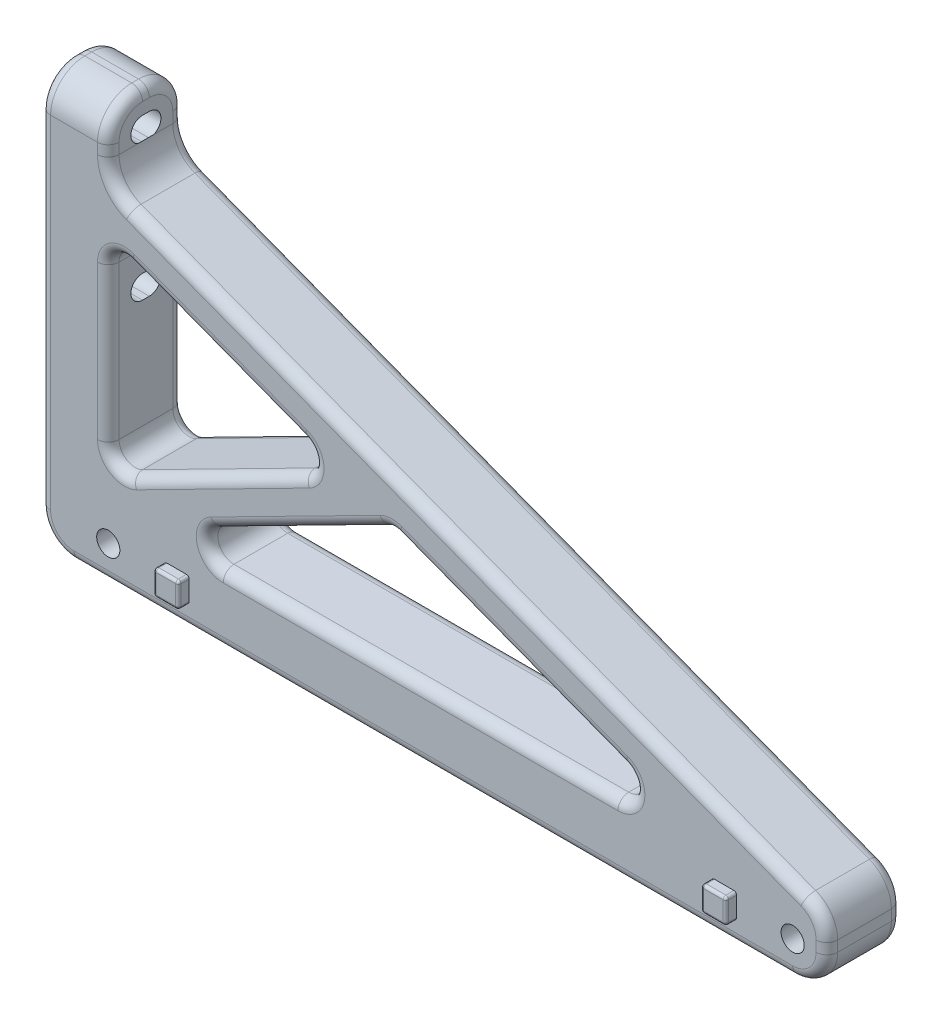
from build123d import *

# Parameters (mm, degrees)
SKETCH1_R           = 2.15
BOSS_EXTRUDE1_DEPTH = 13.97
FILLET1_R           = 3
FILLET2_R           = 6.35
CUT_EXTRUDE1_DEPTH  = 152.183351927
FILLET3_R           = 2
SKETCH3_W           = 4.6228
SKETCH3_H           = 4.6228
BOSS_EXTRUDE2_DEPTH = 2
FILLET4_R           = 0.508


with BuildPart() as part:
    # Sketch1 → Boss-Extrude1 (new body)
    with BuildSketch(Plane.XY):
        Polygon((133.35, 6.35), (0, 57.15), (0, 69.85), (-12.7, 69.85), (-12.7, -6.35), (133.35, -6.35), align=None)
        Circle(SKETCH1_R, mode=Mode.SUBTRACT)
        Polygon((0, 10.838020995), (0, 48.589159979), (42.42795548, 32.42612932), align=None, mode=Mode.SUBTRACT)
        Polygon((110.877794946, 6.35), (8.820483578, 6.35), (52.515998389, 28.583065355), align=None, mode=Mode.SUBTRACT)
        with Locations((127, 0)):
            Circle(SKETCH1_R, mode=Mode.SUBTRACT)
    extrude(amount=BOSS_EXTRUDE1_DEPTH)

    # Fillet1
    fillet1_edges = [part.edges().sort_by_distance(p)[0] for p in [
        (110.877794946, 6.35, 6.985),
        (52.515998389, 28.583065355, 6.985),
        (8.820483578, 6.35, 6.985),
        (0, 10.838020995, 6.985),
        (42.42795548, 32.42612932, 6.985),
        (0, 48.589159979, 6.985),
    ]]
    fillet(fillet1_edges, radius=FILLET1_R)

    # Fillet2
    fillet2_edges = [part.edges().sort_by_distance(p)[0] for p in [
        (133.35, 6.35, 6.985),
        (133.35, -6.35, 6.985),
        (-12.7, -6.35, 6.985),
        (0, 57.15, 6.985),
        (-6.35, 69.85, 0),
        (-6.35, 69.85, 13.97),
    ]]
    fillet(fillet2_edges, radius=FILLET2_R)

    # Sketch2 → Cut-Extrude1 (cut, through all)
    with BuildSketch(Plane(origin=(0, 0, 0), x_dir=(0, 0, -1), z_dir=(1, 0, 0))):
        with BuildLine():
            Line((-7.62, 65.65), (-6.35, 65.65))
            ThreePointArc((-6.35, 65.65), (-4.2, 63.5), (-6.35, 61.35))
            Line((-6.35, 61.35), (-7.62, 61.35))
            ThreePointArc((-7.62, 61.35), (-9.77, 63.5), (-7.62, 65.65))
        make_face()
        with BuildLine():
            Line((-7.62, 35.95), (-6.35, 35.95))
            ThreePointArc((-6.35, 35.95), (-4.2, 38.1), (-6.35, 40.25))
            Line((-6.35, 40.25), (-7.62, 40.25))
            ThreePointArc((-7.62, 40.25), (-9.77, 38.1), (-7.62, 35.95))
        make_face()
    extrude(amount=-CUT_EXTRUDE1_DEPTH, mode=Mode.SUBTRACT)

    # Fillet3
    fillet3_edges = [part.edges().sort_by_distance(p)[0] for p in [
        (1.431785869, 13.173010707, 0),
        (0, 29.983239316, 0),
        (1.297642509, 46.706206235, 0),
        (20.086442529, 40.937181873, 0),
        (38.032644918, 32.191420837, 0),
        (97.526174762, 8.80704034, 0),
        (57.953790951, 6.35, 0),
        (18.414557487, 8.650483328, 0),
        (35.65095639, 20.001828068, 0),
        (52.531016852, 28.301819395, 0),
        (18.414557487, 8.650483328, 13.97),
        (57.953790951, 6.35, 13.97),
        (97.526174762, 8.80704034, 13.97),
        (74.701339099, 20.131506989, 13.97),
        (52.531016852, 28.301819395, 13.97),
        (38.032644918, 32.191420837, 13.97),
        (20.378926173, 21.207185872, 13.97),
        (1.431785869, 13.173010707, 13.97),
        (0, 29.983239316, 13.97),
        (1.297642509, 46.706206235, 13.97),
        (132.22862896, 5.577204208, 13.97),
        (133.35, 0.986940426, 13.97),
        (131.490128061, -4.490128061, 13.97),
        (60.325, -6.35, 13.97),
        (-10.840128061, -4.490128061, 13.97),
        (-12.7, 31.75, 13.97),
        (-12.7, 67.990128061, 12.110128061),
        (-12.7, 69.85, 6.985),
        (-12.7, 67.990128061, 1.859871939),
        (-12.7, 31.75, 0),
        (-10.840128061, -4.490128061, 0),
        (60.325, -6.35, 0),
        (131.490128061, -4.490128061, 0),
        (133.35, 0.986940426, 0),
        (132.22862896, 5.577204208, 0),
        (66.675, 31.75, 0),
        (1.12137104, 57.922795792, 0),
        (0, 62.513059574, 0),
        (0, 67.990128061, 1.859871939),
        (0, 69.85, 6.985),
        (0, 67.990128061, 12.110128061),
        (0, 62.513059574, 13.97),
        (1.12137104, 57.922795792, 13.97),
        (20.378926173, 21.207185872, 0),
        (74.701339099, 20.131506989, 0),
        (35.65095639, 20.001828068, 13.97),
        (20.086442529, 40.937181873, 13.97),
        (66.675, 31.75, 13.97),
    ]]
    fillet(fillet3_edges, radius=FILLET3_R)

    # Sketch3 → Boss-Extrude2 (add)
    with BuildSketch(Plane.XY.offset(13.97)):
        with Locations((12.7, 0)):
            Rectangle(SKETCH3_W, SKETCH3_H)
        with Locations((114.3, 0)):
            Rectangle(SKETCH3_W, SKETCH3_H)
    extrude(amount=BOSS_EXTRUDE2_DEPTH)

    # Fillet4
    fillet4_edges = [part.edges().sort_by_distance(p)[0] for p in [
        (114.3, -2.3114, 15.97),
        (111.9886, 0, 15.97),
        (114.3, 2.3114, 15.97),
        (116.6114, 0, 15.97),
        (12.7, -2.3114, 15.97),
        (10.3886, 0, 15.97),
        (12.7, 2.3114, 15.97),
        (15.0114, 0, 15.97),
        (116.6114, 2.3114, 14.97),
        (116.6114, -2.3114, 14.97),
        (111.9886, -2.3114, 14.97),
        (111.9886, 2.3114, 14.97),
        (10.3886, -2.3114, 14.97),
        (15.0114, -2.3114, 14.97),
        (10.3886, 2.3114, 14.97),
        (15.0114, 2.3114, 14.97),
    ]]
    fillet(fillet4_edges, radius=FILLET4_R)


solid = part.part
